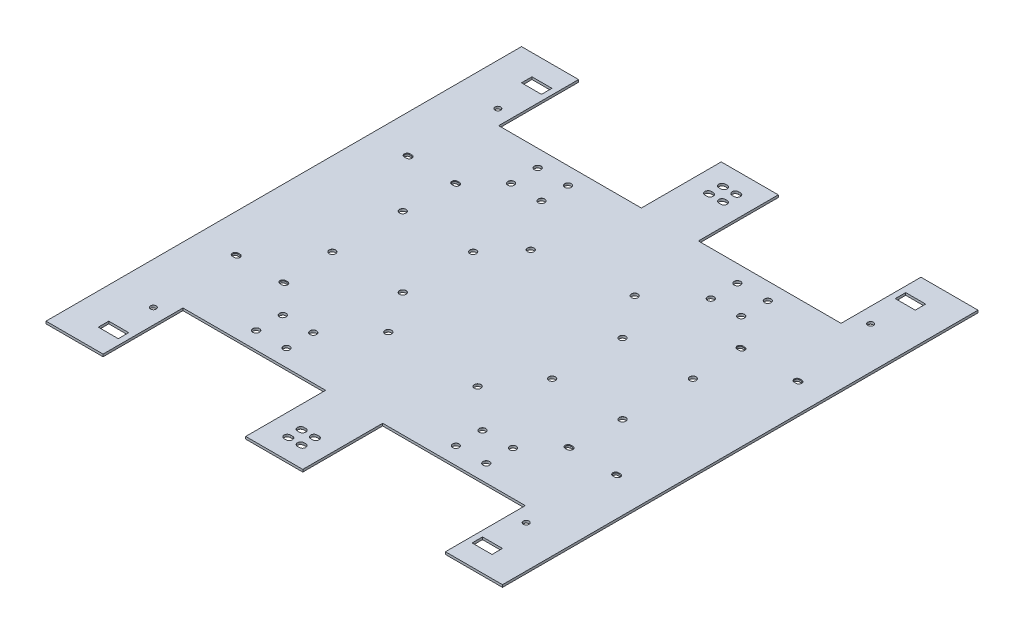
from build123d import *

# Parameters (mm, degrees)
SKETCH2_W                        = 240
SKETCH2_H                        = 1.25
BASE_FLANGE1_DEPTH               = 250
SKETCH7_W                        = 75
SKETCH7_H                        = 42
CUT_EXTRUDE1_DEPTH               = 10
SKETCH8_W                        = 10.5
SKETCH8_H                        = 5.5
CUT_EXTRUDE2_DEPTH               = 10
M3_CLEARANCE_HOLE1_D             = 3.4
M3_CLEARANCE_HOLE1_DEPTH         = 2
M3_CLEARANCE_HOLE1_CSINK_D       = 3.45
M3_CLEARANCE_HOLE1_CSINK_ANGLE   = 90
M3_CLEARANCE_HOLE1_TIP           = 1.021463052
M3_CLEARANCE_HOLE2_D             = 3.4
M3_CLEARANCE_HOLE2_DEPTH         = 2
M3_CLEARANCE_HOLE2_CSINK_D       = 3.45
M3_CLEARANCE_HOLE2_CSINK_ANGLE   = 90
M3_CLEARANCE_HOLE2_TIP           = 1.021463052
SKETCH15_R                       = 1.5
CUT_EXTRUDE3_DEPTH               = 10
TAP_START                        = -2
TAP_DRILL_SLOT_FOR_M3_TAP1_DEPTH = 3
M3_START                         = -2
M3_CLEARANCE_SLOT1_DEPTH         = 3


with BuildPart() as part:
    # Base-Flange1: sheet metal written as solids
    # Sketch2 → Base-Flange1 (new body)
    with BuildSketch(Plane.XY):
        with Locations((0, -0.625)):
            Rectangle(SKETCH2_W, SKETCH2_H)
    extrude(amount=BASE_FLANGE1_DEPTH)

    # Sketch7 → Cut-Extrude1 (cut)
    with BuildSketch(Plane(origin=(0, 0, 0), x_dir=(1, 0, 0), z_dir=(0, 1, 0))):
        with Locations((-52.5, -229)):
            Rectangle(SKETCH7_W, SKETCH7_H)
        with Locations((52.5, -229)):
            Rectangle(SKETCH7_W, SKETCH7_H)
        with Locations((52.5, -21)):
            Rectangle(SKETCH7_W, SKETCH7_H)
        with Locations((-52.5, -21)):
            Rectangle(SKETCH7_W, SKETCH7_H)
    extrude(amount=-CUT_EXTRUDE1_DEPTH, mode=Mode.SUBTRACT)

    # Sketch8 → Cut-Extrude2 (cut)
    with BuildSketch(Plane(origin=(0, 0, 0), x_dir=(1, 0, 0), z_dir=(0, 1, 0))):
        with Locations((-98.25, -236.25)):
            Rectangle(SKETCH8_W, SKETCH8_H)
        with Locations((98.25, -236.25)):
            Rectangle(SKETCH8_W, SKETCH8_H)
        with Locations((98.25, -13.75)):
            Rectangle(SKETCH8_W, SKETCH8_H)
        with Locations((-98.25, -13.75)):
            Rectangle(SKETCH8_W, SKETCH8_H)
    extrude(amount=-CUT_EXTRUDE2_DEPTH, mode=Mode.SUBTRACT)

    # M3 Clearance Hole1
    with Locations(Plane(origin=(0, 0, 0), x_dir=(1, 0, 0), z_dir=(0, 1, 0))):
        with Locations((-60.5, -65), (-44.5, -65), (-44.5, -51), (-60.5, -51), (-60.5, -185), (-44.5, -185), (-44.5, -199), (-60.5, -199), (60.5, -199), (44.5, -199), (44.5, -185), (60.5, -185), (44.5, -51), (60.5, -51), (60.5, -65), (44.5, -65)):
            CounterSinkHole(M3_CLEARANCE_HOLE1_D / 2, M3_CLEARANCE_HOLE1_CSINK_D / 2, depth=M3_CLEARANCE_HOLE1_DEPTH, counter_sink_angle=M3_CLEARANCE_HOLE1_CSINK_ANGLE)
            with Locations((0, 0, -(M3_CLEARANCE_HOLE1_DEPTH + M3_CLEARANCE_HOLE1_TIP / 2))):  # 118° drill point
                Cone(0, M3_CLEARANCE_HOLE1_D / 2, M3_CLEARANCE_HOLE1_TIP, mode=Mode.SUBTRACT)

    # M3 Clearance Hole2
    with Locations(Plane(origin=(0, 0, 0), x_dir=(1, 0, 0), z_dir=(0, 1, 0))):
        with Locations((-76.26435184, -106.15716963), (-39.26435184, -106.15716963), (-39.26435184, -143.15716963), (-76.26435184, -143.15716963), (-25.02817208, -90.1), (23.19782518, -83.70848195), (23.19782518, -166.25848195), (-25.02817208, -165), (39.26435184, -143.15716963), (39.26435184, -106.15716963), (76.26435184, -106.15716963), (76.26435184, -143.15716963)):
            CounterSinkHole(M3_CLEARANCE_HOLE2_D / 2, M3_CLEARANCE_HOLE2_CSINK_D / 2, depth=M3_CLEARANCE_HOLE2_DEPTH, counter_sink_angle=M3_CLEARANCE_HOLE2_CSINK_ANGLE)
            with Locations((0, 0, -(M3_CLEARANCE_HOLE2_DEPTH + M3_CLEARANCE_HOLE2_TIP / 2))):  # 118° drill point
                Cone(0, M3_CLEARANCE_HOLE2_D / 2, M3_CLEARANCE_HOLE2_TIP, mode=Mode.SUBTRACT)

    # Sketch15 → Cut-Extrude3 (cut)
    with BuildSketch(Plane(origin=(0, 0, 0), x_dir=(1, 0, 0), z_dir=(0, 1, 0))):
        with Locations(Location((-98, -215.54908921, 0), (0, 0, 180))):
            Circle(SKETCH15_R)
        with Locations(Location((98, -215.54908921, 0), (0, 0, 180))):
            Circle(SKETCH15_R)
        with Locations(Location((98, -34.45091079, 0), (0, 0, 180))):
            Circle(SKETCH15_R)
        with Locations(Location((-98, -34.45091079, 0), (0, 0, 180))):
            Circle(SKETCH15_R)
    extrude(amount=-CUT_EXTRUDE3_DEPTH, mode=Mode.SUBTRACT)

    # Tap Drill Slot for M3 Tap1: read off the stored shape, not the designer's step
    # Tap Drill Slot for M3 Tap1 outline → Tap Drill Slot for M3 Tap1 (cut)
    with BuildSketch(Plane(origin=(0, 0, 0), x_dir=(1, 0, 0), z_dir=(0, 1, 0)).offset(TAP_START)):
        with BuildLine():
            Line((104.5, -80.87115997), (105.5, -80.87115997))
            ThreePointArc((105.5, -80.87115997), (106.75, -79.62115997), (105.5, -78.37115997))
            Line((105.5, -78.37115997), (104.5, -78.37115997))
            ThreePointArc((104.5, -78.37115997), (103.25, -79.62115997), (104.5, -80.87115997))
        make_face()
        with BuildLine():
            ThreePointArc((74.5, -78.37115997), (73.25, -79.62115997), (74.5, -80.87115997))
            Line((74.5, -80.87115997), (75.5, -80.87115997))
            ThreePointArc((75.5, -80.87115997), (76.75, -79.62115997), (75.5, -78.37115997))
            Line((75.5, -78.37115997), (74.5, -78.37115997))
        make_face()
        with BuildLine():
            ThreePointArc((-75.5, -78.37115997), (-76.75, -79.62115997), (-75.5, -80.87115997))
            Line((-75.5, -80.87115997), (-74.5, -80.87115997))
            ThreePointArc((-74.5, -80.87115997), (-73.25, -79.62115997), (-74.5, -78.37115997))
            Line((-74.5, -78.37115997), (-75.5, -78.37115997))
        make_face()
        with BuildLine():
            ThreePointArc((-100.5, -78.37115997), (-101.75, -79.62115997), (-100.5, -80.87115997))
            Line((-100.5, -80.87115997), (-99.5, -80.87115997))
            ThreePointArc((-99.5, -80.87115997), (-98.25, -79.62115997), (-99.5, -78.37115997))
            Line((-99.5, -78.37115997), (-100.5, -78.37115997))
        make_face()
        with BuildLine():
            Line((75.5, -168.73875708), (74.5, -168.73875708))
            ThreePointArc((74.5, -168.73875708), (73.25, -169.98875708), (74.5, -171.23875708))
            Line((74.5, -171.23875708), (75.5, -171.23875708))
            ThreePointArc((75.5, -171.23875708), (76.75, -169.98875708), (75.5, -168.73875708))
        make_face()
        with BuildLine():
            ThreePointArc((100.5, -171.23875708), (101.75, -169.98875708), (100.5, -168.73875708))
            Line((100.5, -168.73875708), (99.5, -168.73875708))
            ThreePointArc((99.5, -168.73875708), (98.25, -169.98875708), (99.5, -171.23875708))
            Line((99.5, -171.23875708), (100.5, -171.23875708))
        make_face()
        with BuildLine():
            ThreePointArc((-99.5, -171.23875708), (-98.25, -169.98875708), (-99.5, -168.73875708))
            Line((-99.5, -168.73875708), (-100.5, -168.73875708))
            ThreePointArc((-100.5, -168.73875708), (-101.75, -169.98875708), (-100.5, -171.23875708))
            Line((-100.5, -171.23875708), (-99.5, -171.23875708))
        make_face()
        with BuildLine():
            ThreePointArc((-74.5, -171.23875708), (-73.25, -169.98875708), (-74.5, -168.73875708))
            Line((-74.5, -168.73875708), (-75.5, -168.73875708))
            ThreePointArc((-75.5, -168.73875708), (-76.75, -169.98875708), (-75.5, -171.23875708))
            Line((-75.5, -171.23875708), (-74.5, -171.23875708))
        make_face()
    extrude(amount=TAP_DRILL_SLOT_FOR_M3_TAP1_DEPTH, mode=Mode.SUBTRACT)

    # Tap Drill Slot for M3 Tap1 2: loft between two sections, ruled curve by curve
    tap_drill_slot_for_m3_tap1_2_from = [
        Edge.make_three_point_arc((104.5, -0.25, 78.37115997), (103.616116524, -0.25, 78.737276494), (103.25, -0.25, 79.62115997)),
        Edge.make_three_point_arc((103.25, -0.25, 79.62115997), (103.616116524, -0.25, 80.505043446), (104.5, -0.25, 80.87115997)),
        Edge.make_three_point_arc((105.5, -0.25, 80.87115997), (106.383883476, -0.25, 80.505043446), (106.75, -0.25, 79.62115997)),
        Edge.make_three_point_arc((106.75, -0.25, 79.62115997), (106.383883476, -0.25, 78.737276494), (105.5, -0.25, 78.37115997)),
        Edge.make_line((104.5, -0.25, 80.87115997), (105.5, -0.25, 80.87115997)),
        Edge.make_line((104.5, -0.25, 78.37115997), (105.5, -0.25, 78.37115997)),
    ]
    tap_drill_slot_for_m3_tap1_2_to = [
        Edge.make_three_point_arc((104.5, 0, 78.12115997), (103.439339828, 0, 78.560499798), (103, 0, 79.62115997)),
        Edge.make_three_point_arc((103, 0, 79.62115997), (103.439339828, 0, 80.681820142), (104.5, 0, 81.12115997)),
        Edge.make_three_point_arc((105.5, 0, 81.12115997), (106.560660172, 0, 80.681820142), (107, 0, 79.62115997)),
        Edge.make_three_point_arc((107, 0, 79.62115997), (106.560660172, 0, 78.560499798), (105.5, 0, 78.12115997)),
        Edge.make_line((104.5, 0, 81.12115997), (105.5, 0, 81.12115997)),
        Edge.make_line((104.5, 0, 78.12115997), (105.5, 0, 78.12115997)),
    ]
    tap_drill_slot_for_m3_tap1_2 = Solid(Shell([*[Face.make_surface_from_curves(tap_drill_slot_for_m3_tap1_2_from[k], tap_drill_slot_for_m3_tap1_2_to[k]) for k in range(6)], Face(Wire(tap_drill_slot_for_m3_tap1_2_from)), Face(Wire(tap_drill_slot_for_m3_tap1_2_to))]))
    add(tap_drill_slot_for_m3_tap1_2, mode=Mode.SUBTRACT)

    # Tap Drill Slot for M3 Tap1 3: loft between two sections, ruled curve by curve
    tap_drill_slot_for_m3_tap1_3_from = [
        Edge.make_three_point_arc((74.5, -0.25, 78.37115997), (73.616116524, -0.25, 78.737276494), (73.25, -0.25, 79.62115997)),
        Edge.make_three_point_arc((73.25, -0.25, 79.62115997), (73.616116524, -0.25, 80.505043446), (74.5, -0.25, 80.87115997)),
        Edge.make_three_point_arc((75.5, -0.25, 80.87115997), (76.383883476, -0.25, 80.505043446), (76.75, -0.25, 79.62115997)),
        Edge.make_three_point_arc((76.75, -0.25, 79.62115997), (76.383883476, -0.25, 78.737276494), (75.5, -0.25, 78.37115997)),
        Edge.make_line((74.5, -0.25, 80.87115997), (75.5, -0.25, 80.87115997)),
        Edge.make_line((74.5, -0.25, 78.37115997), (75.5, -0.25, 78.37115997)),
    ]
    tap_drill_slot_for_m3_tap1_3_to = [
        Edge.make_three_point_arc((74.5, 0, 78.12115997), (73.439339828, 0, 78.560499798), (73, 0, 79.62115997)),
        Edge.make_three_point_arc((73, 0, 79.62115997), (73.439339828, 0, 80.681820142), (74.5, 0, 81.12115997)),
        Edge.make_three_point_arc((75.5, 0, 81.12115997), (76.560660172, 0, 80.681820142), (77, 0, 79.62115997)),
        Edge.make_three_point_arc((77, 0, 79.62115997), (76.560660172, 0, 78.560499798), (75.5, 0, 78.12115997)),
        Edge.make_line((74.5, 0, 81.12115997), (75.5, 0, 81.12115997)),
        Edge.make_line((74.5, 0, 78.12115997), (75.5, 0, 78.12115997)),
    ]
    tap_drill_slot_for_m3_tap1_3 = Solid(Shell([*[Face.make_surface_from_curves(tap_drill_slot_for_m3_tap1_3_from[k], tap_drill_slot_for_m3_tap1_3_to[k]) for k in range(6)], Face(Wire(tap_drill_slot_for_m3_tap1_3_from)), Face(Wire(tap_drill_slot_for_m3_tap1_3_to))]))
    add(tap_drill_slot_for_m3_tap1_3, mode=Mode.SUBTRACT)

    # Tap Drill Slot for M3 Tap1 4: loft between two sections, ruled curve by curve
    tap_drill_slot_for_m3_tap1_4_from = [
        Edge.make_three_point_arc((-75.5, -0.25, 78.37115997), (-76.383883476, -0.25, 78.737276494), (-76.75, -0.25, 79.62115997)),
        Edge.make_three_point_arc((-76.75, -0.25, 79.62115997), (-76.383883476, -0.25, 80.505043446), (-75.5, -0.25, 80.87115997)),
        Edge.make_three_point_arc((-74.5, -0.25, 80.87115997), (-73.616116524, -0.25, 80.505043446), (-73.25, -0.25, 79.62115997)),
        Edge.make_three_point_arc((-73.25, -0.25, 79.62115997), (-73.616116524, -0.25, 78.737276494), (-74.5, -0.25, 78.37115997)),
        Edge.make_line((-75.5, -0.25, 80.87115997), (-74.5, -0.25, 80.87115997)),
        Edge.make_line((-75.5, -0.25, 78.37115997), (-74.5, -0.25, 78.37115997)),
    ]
    tap_drill_slot_for_m3_tap1_4_to = [
        Edge.make_three_point_arc((-75.5, 0, 78.12115997), (-76.560660172, 0, 78.560499798), (-77, 0, 79.62115997)),
        Edge.make_three_point_arc((-77, 0, 79.62115997), (-76.560660172, 0, 80.681820142), (-75.5, 0, 81.12115997)),
        Edge.make_three_point_arc((-74.5, 0, 81.12115997), (-73.439339828, 0, 80.681820142), (-73, 0, 79.62115997)),
        Edge.make_three_point_arc((-73, 0, 79.62115997), (-73.439339828, 0, 78.560499798), (-74.5, 0, 78.12115997)),
        Edge.make_line((-75.5, 0, 81.12115997), (-74.5, 0, 81.12115997)),
        Edge.make_line((-75.5, 0, 78.12115997), (-74.5, 0, 78.12115997)),
    ]
    tap_drill_slot_for_m3_tap1_4 = Solid(Shell([*[Face.make_surface_from_curves(tap_drill_slot_for_m3_tap1_4_from[k], tap_drill_slot_for_m3_tap1_4_to[k]) for k in range(6)], Face(Wire(tap_drill_slot_for_m3_tap1_4_from)), Face(Wire(tap_drill_slot_for_m3_tap1_4_to))]))
    add(tap_drill_slot_for_m3_tap1_4, mode=Mode.SUBTRACT)

    # Tap Drill Slot for M3 Tap1 5: loft between two sections, ruled curve by curve
    tap_drill_slot_for_m3_tap1_5_from = [
        Edge.make_three_point_arc((-100.5, -0.25, 78.37115997), (-101.383883476, -0.25, 78.737276494), (-101.75, -0.25, 79.62115997)),
        Edge.make_three_point_arc((-101.75, -0.25, 79.62115997), (-101.383883476, -0.25, 80.505043446), (-100.5, -0.25, 80.87115997)),
        Edge.make_three_point_arc((-99.5, -0.25, 80.87115997), (-98.616116524, -0.25, 80.505043446), (-98.25, -0.25, 79.62115997)),
        Edge.make_three_point_arc((-98.25, -0.25, 79.62115997), (-98.616116524, -0.25, 78.737276494), (-99.5, -0.25, 78.37115997)),
        Edge.make_line((-100.5, -0.25, 80.87115997), (-99.5, -0.25, 80.87115997)),
        Edge.make_line((-100.5, -0.25, 78.37115997), (-99.5, -0.25, 78.37115997)),
    ]
    tap_drill_slot_for_m3_tap1_5_to = [
        Edge.make_three_point_arc((-100.5, 0, 78.12115997), (-101.560660172, 0, 78.560499798), (-102, 0, 79.62115997)),
        Edge.make_three_point_arc((-102, 0, 79.62115997), (-101.560660172, 0, 80.681820142), (-100.5, 0, 81.12115997)),
        Edge.make_three_point_arc((-99.5, 0, 81.12115997), (-98.439339828, 0, 80.681820142), (-98, 0, 79.62115997)),
        Edge.make_three_point_arc((-98, 0, 79.62115997), (-98.439339828, 0, 78.560499798), (-99.5, 0, 78.12115997)),
        Edge.make_line((-100.5, 0, 81.12115997), (-99.5, 0, 81.12115997)),
        Edge.make_line((-100.5, 0, 78.12115997), (-99.5, 0, 78.12115997)),
    ]
    tap_drill_slot_for_m3_tap1_5 = Solid(Shell([*[Face.make_surface_from_curves(tap_drill_slot_for_m3_tap1_5_from[k], tap_drill_slot_for_m3_tap1_5_to[k]) for k in range(6)], Face(Wire(tap_drill_slot_for_m3_tap1_5_from)), Face(Wire(tap_drill_slot_for_m3_tap1_5_to))]))
    add(tap_drill_slot_for_m3_tap1_5, mode=Mode.SUBTRACT)

    # Tap Drill Slot for M3 Tap1 6: loft between two sections, ruled curve by curve
    tap_drill_slot_for_m3_tap1_6_from = [
        Edge.make_three_point_arc((74.5, -0.25, 168.73875708), (73.616116524, -0.25, 169.104873604), (73.25, -0.25, 169.98875708)),
        Edge.make_three_point_arc((73.25, -0.25, 169.98875708), (73.616116524, -0.25, 170.872640556), (74.5, -0.25, 171.23875708)),
        Edge.make_three_point_arc((75.5, -0.25, 171.23875708), (76.383883476, -0.25, 170.872640556), (76.75, -0.25, 169.98875708)),
        Edge.make_three_point_arc((76.75, -0.25, 169.98875708), (76.383883476, -0.25, 169.104873604), (75.5, -0.25, 168.73875708)),
        Edge.make_line((74.5, -0.25, 171.23875708), (75.5, -0.25, 171.23875708)),
        Edge.make_line((74.5, -0.25, 168.73875708), (75.5, -0.25, 168.73875708)),
    ]
    tap_drill_slot_for_m3_tap1_6_to = [
        Edge.make_three_point_arc((74.5, 0, 168.48875708), (73.439339828, 0, 168.928096908), (73, 0, 169.98875708)),
        Edge.make_three_point_arc((73, 0, 169.98875708), (73.439339828, 0, 171.049417252), (74.5, 0, 171.48875708)),
        Edge.make_three_point_arc((75.5, 0, 171.48875708), (76.560660172, 0, 171.049417252), (77, 0, 169.98875708)),
        Edge.make_three_point_arc((77, 0, 169.98875708), (76.560660172, 0, 168.928096908), (75.5, 0, 168.48875708)),
        Edge.make_line((74.5, 0, 171.48875708), (75.5, 0, 171.48875708)),
        Edge.make_line((74.5, 0, 168.48875708), (75.5, 0, 168.48875708)),
    ]
    tap_drill_slot_for_m3_tap1_6 = Solid(Shell([*[Face.make_surface_from_curves(tap_drill_slot_for_m3_tap1_6_from[k], tap_drill_slot_for_m3_tap1_6_to[k]) for k in range(6)], Face(Wire(tap_drill_slot_for_m3_tap1_6_from)), Face(Wire(tap_drill_slot_for_m3_tap1_6_to))]))
    add(tap_drill_slot_for_m3_tap1_6, mode=Mode.SUBTRACT)

    # Tap Drill Slot for M3 Tap1 7: loft between two sections, ruled curve by curve
    tap_drill_slot_for_m3_tap1_7_from = [
        Edge.make_three_point_arc((99.5, -0.25, 168.73875708), (98.616116524, -0.25, 169.104873604), (98.25, -0.25, 169.98875708)),
        Edge.make_three_point_arc((98.25, -0.25, 169.98875708), (98.616116524, -0.25, 170.872640556), (99.5, -0.25, 171.23875708)),
        Edge.make_three_point_arc((100.5, -0.25, 171.23875708), (101.383883476, -0.25, 170.872640556), (101.75, -0.25, 169.98875708)),
        Edge.make_three_point_arc((101.75, -0.25, 169.98875708), (101.383883476, -0.25, 169.104873604), (100.5, -0.25, 168.73875708)),
        Edge.make_line((99.5, -0.25, 171.23875708), (100.5, -0.25, 171.23875708)),
        Edge.make_line((99.5, -0.25, 168.73875708), (100.5, -0.25, 168.73875708)),
    ]
    tap_drill_slot_for_m3_tap1_7_to = [
        Edge.make_three_point_arc((99.5, 0, 168.48875708), (98.439339828, 0, 168.928096908), (98, 0, 169.98875708)),
        Edge.make_three_point_arc((98, 0, 169.98875708), (98.439339828, 0, 171.049417252), (99.5, 0, 171.48875708)),
        Edge.make_three_point_arc((100.5, 0, 171.48875708), (101.560660172, 0, 171.049417252), (102, 0, 169.98875708)),
        Edge.make_three_point_arc((102, 0, 169.98875708), (101.560660172, 0, 168.928096908), (100.5, 0, 168.48875708)),
        Edge.make_line((99.5, 0, 171.48875708), (100.5, 0, 171.48875708)),
        Edge.make_line((99.5, 0, 168.48875708), (100.5, 0, 168.48875708)),
    ]
    tap_drill_slot_for_m3_tap1_7 = Solid(Shell([*[Face.make_surface_from_curves(tap_drill_slot_for_m3_tap1_7_from[k], tap_drill_slot_for_m3_tap1_7_to[k]) for k in range(6)], Face(Wire(tap_drill_slot_for_m3_tap1_7_from)), Face(Wire(tap_drill_slot_for_m3_tap1_7_to))]))
    add(tap_drill_slot_for_m3_tap1_7, mode=Mode.SUBTRACT)

    # Tap Drill Slot for M3 Tap1 8: loft between two sections, ruled curve by curve
    tap_drill_slot_for_m3_tap1_8_from = [
        Edge.make_three_point_arc((-100.5, -0.25, 168.73875708), (-101.383883476, -0.25, 169.104873604), (-101.75, -0.25, 169.98875708)),
        Edge.make_three_point_arc((-101.75, -0.25, 169.98875708), (-101.383883476, -0.25, 170.872640556), (-100.5, -0.25, 171.23875708)),
        Edge.make_three_point_arc((-99.5, -0.25, 171.23875708), (-98.616116524, -0.25, 170.872640556), (-98.25, -0.25, 169.98875708)),
        Edge.make_three_point_arc((-98.25, -0.25, 169.98875708), (-98.616116524, -0.25, 169.104873604), (-99.5, -0.25, 168.73875708)),
        Edge.make_line((-100.5, -0.25, 171.23875708), (-99.5, -0.25, 171.23875708)),
        Edge.make_line((-100.5, -0.25, 168.73875708), (-99.5, -0.25, 168.73875708)),
    ]
    tap_drill_slot_for_m3_tap1_8_to = [
        Edge.make_three_point_arc((-100.5, 0, 168.48875708), (-101.560660172, 0, 168.928096908), (-102, 0, 169.98875708)),
        Edge.make_three_point_arc((-102, 0, 169.98875708), (-101.560660172, 0, 171.049417252), (-100.5, 0, 171.48875708)),
        Edge.make_three_point_arc((-99.5, 0, 171.48875708), (-98.439339828, 0, 171.049417252), (-98, 0, 169.98875708)),
        Edge.make_three_point_arc((-98, 0, 169.98875708), (-98.439339828, 0, 168.928096908), (-99.5, 0, 168.48875708)),
        Edge.make_line((-100.5, 0, 171.48875708), (-99.5, 0, 171.48875708)),
        Edge.make_line((-100.5, 0, 168.48875708), (-99.5, 0, 168.48875708)),
    ]
    tap_drill_slot_for_m3_tap1_8 = Solid(Shell([*[Face.make_surface_from_curves(tap_drill_slot_for_m3_tap1_8_from[k], tap_drill_slot_for_m3_tap1_8_to[k]) for k in range(6)], Face(Wire(tap_drill_slot_for_m3_tap1_8_from)), Face(Wire(tap_drill_slot_for_m3_tap1_8_to))]))
    add(tap_drill_slot_for_m3_tap1_8, mode=Mode.SUBTRACT)

    # Tap Drill Slot for M3 Tap1 9: loft between two sections, ruled curve by curve
    tap_drill_slot_for_m3_tap1_9_from = [
        Edge.make_three_point_arc((-75.5, -0.25, 168.73875708), (-76.383883476, -0.25, 169.104873604), (-76.75, -0.25, 169.98875708)),
        Edge.make_three_point_arc((-76.75, -0.25, 169.98875708), (-76.383883476, -0.25, 170.872640556), (-75.5, -0.25, 171.23875708)),
        Edge.make_three_point_arc((-74.5, -0.25, 171.23875708), (-73.616116524, -0.25, 170.872640556), (-73.25, -0.25, 169.98875708)),
        Edge.make_three_point_arc((-73.25, -0.25, 169.98875708), (-73.616116524, -0.25, 169.104873604), (-74.5, -0.25, 168.73875708)),
        Edge.make_line((-75.5, -0.25, 171.23875708), (-74.5, -0.25, 171.23875708)),
        Edge.make_line((-75.5, -0.25, 168.73875708), (-74.5, -0.25, 168.73875708)),
    ]
    tap_drill_slot_for_m3_tap1_9_to = [
        Edge.make_three_point_arc((-75.5, 0, 168.48875708), (-76.560660172, 0, 168.928096908), (-77, 0, 169.98875708)),
        Edge.make_three_point_arc((-77, 0, 169.98875708), (-76.560660172, 0, 171.049417252), (-75.5, 0, 171.48875708)),
        Edge.make_three_point_arc((-74.5, 0, 171.48875708), (-73.439339828, 0, 171.049417252), (-73, 0, 169.98875708)),
        Edge.make_three_point_arc((-73, 0, 169.98875708), (-73.439339828, 0, 168.928096908), (-74.5, 0, 168.48875708)),
        Edge.make_line((-75.5, 0, 171.48875708), (-74.5, 0, 171.48875708)),
        Edge.make_line((-75.5, 0, 168.48875708), (-74.5, 0, 168.48875708)),
    ]
    tap_drill_slot_for_m3_tap1_9 = Solid(Shell([*[Face.make_surface_from_curves(tap_drill_slot_for_m3_tap1_9_from[k], tap_drill_slot_for_m3_tap1_9_to[k]) for k in range(6)], Face(Wire(tap_drill_slot_for_m3_tap1_9_from)), Face(Wire(tap_drill_slot_for_m3_tap1_9_to))]))
    add(tap_drill_slot_for_m3_tap1_9, mode=Mode.SUBTRACT)

    # M3 Clearance Slot1: read off the stored shape, not the designer's step
    # M3 Clearance Slot1 outline → M3 Clearance Slot1 (cut)
    with BuildSketch(Plane(origin=(0, 0, 0), x_dir=(1, 0, 0), z_dir=(0, 1, 0)).offset(M3_START)):
        with BuildLine():
            ThreePointArc((-4.164993461, -16.05), (-5.864993461, -17.75), (-4.164993461, -19.45))
            Line((-4.164993461, -19.45), (-3.164993461, -19.45))
            ThreePointArc((-3.164993461, -19.45), (-1.464993461, -17.75), (-3.164993461, -16.05))
            Line((-3.164993461, -16.05), (-4.164993461, -16.05))
        make_face()
        with BuildLine():
            ThreePointArc((-3.863364536, -9.026451441), (-5.563364536, -10.726451441), (-3.863364536, -12.426451441))
            Line((-3.863364536, -12.426451441), (-2.863364536, -12.426451441))
            ThreePointArc((-2.863364536, -12.426451441), (-1.163364536, -10.726451441), (-2.863364536, -9.026451441))
            Line((-2.863364536, -9.026451441), (-3.863364536, -9.026451441))
        make_face()
        with BuildLine():
            ThreePointArc((4.136635464, -12.426451441), (5.836635464, -10.726451441), (4.136635464, -9.026451441))
            Line((4.136635464, -9.026451441), (3.136635464, -9.026451441))
            ThreePointArc((3.136635464, -9.026451441), (1.436635464, -10.726451441), (3.136635464, -12.426451441))
            Line((3.136635464, -12.426451441), (4.136635464, -12.426451441))
        make_face()
        with BuildLine():
            ThreePointArc((3.136635464, -15.997534094), (1.436635464, -17.697534094), (3.136635464, -19.397534094))
            Line((3.136635464, -19.397534094), (4.136635464, -19.397534094))
            ThreePointArc((4.136635464, -19.397534094), (5.836635464, -17.697534094), (4.136635464, -15.997534094))
            Line((4.136635464, -15.997534094), (3.136635464, -15.997534094))
        make_face()
        with BuildLine():
            ThreePointArc((-3.863364536, -230.55), (-5.563364536, -232.25), (-3.863364536, -233.95))
            Line((-3.863364536, -233.95), (-2.863364536, -233.95))
            ThreePointArc((-2.863364536, -233.95), (-1.163364536, -232.25), (-2.863364536, -230.55))
            Line((-2.863364536, -230.55), (-3.863364536, -230.55))
        make_face()
        with BuildLine():
            ThreePointArc((4.136635464, -233.95), (5.836635464, -232.25), (4.136635464, -230.55))
            Line((4.136635464, -230.55), (3.136635464, -230.55))
            ThreePointArc((3.136635464, -230.55), (1.436635464, -232.25), (3.136635464, -233.95))
            Line((3.136635464, -233.95), (4.136635464, -233.95))
        make_face()
        with BuildLine():
            ThreePointArc((3.136635464, -237.55), (1.436635464, -239.25), (3.136635464, -240.95))
            Line((3.136635464, -240.95), (4.136635464, -240.95))
            ThreePointArc((4.136635464, -240.95), (5.836635464, -239.25), (4.136635464, -237.55))
            Line((4.136635464, -237.55), (3.136635464, -237.55))
        make_face()
        with BuildLine():
            ThreePointArc((-2.863364536, -240.95), (-1.163364536, -239.25), (-2.863364536, -237.55))
            Line((-2.863364536, -237.55), (-3.863364536, -237.55))
            ThreePointArc((-3.863364536, -237.55), (-5.563364536, -239.25), (-3.863364536, -240.95))
            Line((-3.863364536, -240.95), (-2.863364536, -240.95))
        make_face()
    extrude(amount=M3_CLEARANCE_SLOT1_DEPTH, mode=Mode.SUBTRACT)

    # M3 Clearance Slot1 2: loft between two sections, ruled curve by curve
    m3_clearance_slot1_2_from = [
        Edge.make_three_point_arc((-4.164993461, -1.225, 19.45), (-5.367074989, -1.225, 18.952081528), (-5.864993461, -1.225, 17.75)),
        Edge.make_three_point_arc((-5.864993461, -1.225, 17.75), (-5.367074989, -1.225, 16.547918472), (-4.164993461, -1.225, 16.05)),
        Edge.make_three_point_arc((-3.164993461, -1.225, 16.05), (-1.962911933, -1.225, 16.547918472), (-1.464993461, -1.225, 17.75)),
        Edge.make_three_point_arc((-1.464993461, -1.225, 17.75), (-1.962911933, -1.225, 18.952081528), (-3.164993461, -1.225, 19.45)),
        Edge.make_line((-4.164993461, -1.225, 16.05), (-3.164993461, -1.225, 16.05)),
        Edge.make_line((-4.164993461, -1.225, 19.45), (-3.164993461, -1.225, 19.45)),
    ]
    m3_clearance_slot1_2_to = [
        Edge.make_three_point_arc((-4.164993461, -1.25, 19.475), (-5.384752658, -1.25, 18.969759198), (-5.889993461, -1.25, 17.75)),
        Edge.make_three_point_arc((-5.889993461, -1.25, 17.75), (-5.384752658, -1.25, 16.530240802), (-4.164993461, -1.25, 16.025)),
        Edge.make_three_point_arc((-3.164993461, -1.25, 16.025), (-1.945234263, -1.25, 16.530240802), (-1.439993461, -1.25, 17.75)),
        Edge.make_three_point_arc((-1.439993461, -1.25, 17.75), (-1.945234263, -1.25, 18.969759198), (-3.164993461, -1.25, 19.475)),
        Edge.make_line((-4.164993461, -1.25, 16.025), (-3.164993461, -1.25, 16.025)),
        Edge.make_line((-4.164993461, -1.25, 19.475), (-3.164993461, -1.25, 19.475)),
    ]
    m3_clearance_slot1_2 = Solid(Shell([*[Face.make_surface_from_curves(m3_clearance_slot1_2_from[k], m3_clearance_slot1_2_to[k]) for k in range(6)], Face(Wire(m3_clearance_slot1_2_from)), Face(Wire(m3_clearance_slot1_2_to))]))
    add(m3_clearance_slot1_2, mode=Mode.SUBTRACT)

    # M3 Clearance Slot1 3: loft between two sections, ruled curve by curve
    m3_clearance_slot1_3_from = [
        Edge.make_three_point_arc((-3.863364536, -1.225, 12.426451441), (-5.065446064, -1.225, 11.928532969), (-5.563364536, -1.225, 10.726451441)),
        Edge.make_three_point_arc((-5.563364536, -1.225, 10.726451441), (-5.065446064, -1.225, 9.524369913), (-3.863364536, -1.225, 9.026451441)),
        Edge.make_three_point_arc((-2.863364536, -1.225, 9.026451441), (-1.661283008, -1.225, 9.524369913), (-1.163364536, -1.225, 10.726451441)),
        Edge.make_three_point_arc((-1.163364536, -1.225, 10.726451441), (-1.661283008, -1.225, 11.928532969), (-2.863364536, -1.225, 12.426451441)),
        Edge.make_line((-3.863364536, -1.225, 9.026451441), (-2.863364536, -1.225, 9.026451441)),
        Edge.make_line((-3.863364536, -1.225, 12.426451441), (-2.863364536, -1.225, 12.426451441)),
    ]
    m3_clearance_slot1_3_to = [
        Edge.make_three_point_arc((-3.863364536, -1.25, 12.451451441), (-5.083123734, -1.25, 11.946210639), (-5.588364536, -1.25, 10.726451441)),
        Edge.make_three_point_arc((-5.588364536, -1.25, 10.726451441), (-5.083123734, -1.25, 9.506692244), (-3.863364536, -1.25, 9.001451441)),
        Edge.make_three_point_arc((-2.863364536, -1.25, 9.001451441), (-1.643605339, -1.25, 9.506692244), (-1.138364536, -1.25, 10.726451441)),
        Edge.make_three_point_arc((-1.138364536, -1.25, 10.726451441), (-1.643605339, -1.25, 11.946210639), (-2.863364536, -1.25, 12.451451441)),
        Edge.make_line((-3.863364536, -1.25, 9.001451441), (-2.863364536, -1.25, 9.001451441)),
        Edge.make_line((-3.863364536, -1.25, 12.451451441), (-2.863364536, -1.25, 12.451451441)),
    ]
    m3_clearance_slot1_3 = Solid(Shell([*[Face.make_surface_from_curves(m3_clearance_slot1_3_from[k], m3_clearance_slot1_3_to[k]) for k in range(6)], Face(Wire(m3_clearance_slot1_3_from)), Face(Wire(m3_clearance_slot1_3_to))]))
    add(m3_clearance_slot1_3, mode=Mode.SUBTRACT)

    # M3 Clearance Slot1 4: loft between two sections, ruled curve by curve
    m3_clearance_slot1_4_from = [
        Edge.make_three_point_arc((3.136635464, -1.225, 12.426451441), (1.934553936, -1.225, 11.928532969), (1.436635464, -1.225, 10.726451441)),
        Edge.make_three_point_arc((1.436635464, -1.225, 10.726451441), (1.934553936, -1.225, 9.524369913), (3.136635464, -1.225, 9.026451441)),
        Edge.make_three_point_arc((4.136635464, -1.225, 9.026451441), (5.338716992, -1.225, 9.524369913), (5.836635464, -1.225, 10.726451441)),
        Edge.make_three_point_arc((5.836635464, -1.225, 10.726451441), (5.338716992, -1.225, 11.928532969), (4.136635464, -1.225, 12.426451441)),
        Edge.make_line((3.136635464, -1.225, 9.026451441), (4.136635464, -1.225, 9.026451441)),
        Edge.make_line((3.136635464, -1.225, 12.426451441), (4.136635464, -1.225, 12.426451441)),
    ]
    m3_clearance_slot1_4_to = [
        Edge.make_three_point_arc((3.136635464, -1.25, 12.451451441), (1.916876266, -1.25, 11.946210639), (1.411635464, -1.25, 10.726451441)),
        Edge.make_three_point_arc((1.411635464, -1.25, 10.726451441), (1.916876266, -1.25, 9.506692244), (3.136635464, -1.25, 9.001451441)),
        Edge.make_three_point_arc((4.136635464, -1.25, 9.001451441), (5.356394661, -1.25, 9.506692244), (5.861635464, -1.25, 10.726451441)),
        Edge.make_three_point_arc((5.861635464, -1.25, 10.726451441), (5.356394661, -1.25, 11.946210639), (4.136635464, -1.25, 12.451451441)),
        Edge.make_line((3.136635464, -1.25, 9.001451441), (4.136635464, -1.25, 9.001451441)),
        Edge.make_line((3.136635464, -1.25, 12.451451441), (4.136635464, -1.25, 12.451451441)),
    ]
    m3_clearance_slot1_4 = Solid(Shell([*[Face.make_surface_from_curves(m3_clearance_slot1_4_from[k], m3_clearance_slot1_4_to[k]) for k in range(6)], Face(Wire(m3_clearance_slot1_4_from)), Face(Wire(m3_clearance_slot1_4_to))]))
    add(m3_clearance_slot1_4, mode=Mode.SUBTRACT)

    # M3 Clearance Slot1 5: loft between two sections, ruled curve by curve
    m3_clearance_slot1_5_from = [
        Edge.make_three_point_arc((3.136635464, -1.225, 19.397534094), (1.934553936, -1.225, 18.899615622), (1.436635464, -1.225, 17.697534094)),
        Edge.make_three_point_arc((1.436635464, -1.225, 17.697534094), (1.934553936, -1.225, 16.495452566), (3.136635464, -1.225, 15.997534094)),
        Edge.make_three_point_arc((4.136635464, -1.225, 15.997534094), (5.338716992, -1.225, 16.495452566), (5.836635464, -1.225, 17.697534094)),
        Edge.make_three_point_arc((5.836635464, -1.225, 17.697534094), (5.338716992, -1.225, 18.899615622), (4.136635464, -1.225, 19.397534094)),
        Edge.make_line((3.136635464, -1.225, 15.997534094), (4.136635464, -1.225, 15.997534094)),
        Edge.make_line((3.136635464, -1.225, 19.397534094), (4.136635464, -1.225, 19.397534094)),
    ]
    m3_clearance_slot1_5_to = [
        Edge.make_three_point_arc((3.136635464, -1.25, 19.422534094), (1.916876266, -1.25, 18.917293291), (1.411635464, -1.25, 17.697534094)),
        Edge.make_three_point_arc((1.411635464, -1.25, 17.697534094), (1.916876266, -1.25, 16.477774896), (3.136635464, -1.25, 15.972534094)),
        Edge.make_three_point_arc((4.136635464, -1.25, 15.972534094), (5.356394661, -1.25, 16.477774896), (5.861635464, -1.25, 17.697534094)),
        Edge.make_three_point_arc((5.861635464, -1.25, 17.697534094), (5.356394661, -1.25, 18.917293291), (4.136635464, -1.25, 19.422534094)),
        Edge.make_line((3.136635464, -1.25, 15.972534094), (4.136635464, -1.25, 15.972534094)),
        Edge.make_line((3.136635464, -1.25, 19.422534094), (4.136635464, -1.25, 19.422534094)),
    ]
    m3_clearance_slot1_5 = Solid(Shell([*[Face.make_surface_from_curves(m3_clearance_slot1_5_from[k], m3_clearance_slot1_5_to[k]) for k in range(6)], Face(Wire(m3_clearance_slot1_5_from)), Face(Wire(m3_clearance_slot1_5_to))]))
    add(m3_clearance_slot1_5, mode=Mode.SUBTRACT)

    # M3 Clearance Slot1 6: loft between two sections, ruled curve by curve
    m3_clearance_slot1_6_from = [
        Edge.make_three_point_arc((-3.863364536, -1.225, 233.95), (-5.065446064, -1.225, 233.452081528), (-5.563364536, -1.225, 232.25)),
        Edge.make_three_point_arc((-5.563364536, -1.225, 232.25), (-5.065446064, -1.225, 231.047918472), (-3.863364536, -1.225, 230.55)),
        Edge.make_three_point_arc((-2.863364536, -1.225, 230.55), (-1.661283008, -1.225, 231.047918472), (-1.163364536, -1.225, 232.25)),
        Edge.make_three_point_arc((-1.163364536, -1.225, 232.25), (-1.661283008, -1.225, 233.452081528), (-2.863364536, -1.225, 233.95)),
        Edge.make_line((-3.863364536, -1.225, 230.55), (-2.863364536, -1.225, 230.55)),
        Edge.make_line((-3.863364536, -1.225, 233.95), (-2.863364536, -1.225, 233.95)),
    ]
    m3_clearance_slot1_6_to = [
        Edge.make_three_point_arc((-3.863364536, -1.25, 233.975), (-5.083123734, -1.25, 233.469759198), (-5.588364536, -1.25, 232.25)),
        Edge.make_three_point_arc((-5.588364536, -1.25, 232.25), (-5.083123734, -1.25, 231.030240802), (-3.863364536, -1.25, 230.525)),
        Edge.make_three_point_arc((-2.863364536, -1.25, 230.525), (-1.643605339, -1.25, 231.030240802), (-1.138364536, -1.25, 232.25)),
        Edge.make_three_point_arc((-1.138364536, -1.25, 232.25), (-1.643605339, -1.25, 233.469759198), (-2.863364536, -1.25, 233.975)),
        Edge.make_line((-3.863364536, -1.25, 230.525), (-2.863364536, -1.25, 230.525)),
        Edge.make_line((-3.863364536, -1.25, 233.975), (-2.863364536, -1.25, 233.975)),
    ]
    m3_clearance_slot1_6 = Solid(Shell([*[Face.make_surface_from_curves(m3_clearance_slot1_6_from[k], m3_clearance_slot1_6_to[k]) for k in range(6)], Face(Wire(m3_clearance_slot1_6_from)), Face(Wire(m3_clearance_slot1_6_to))]))
    add(m3_clearance_slot1_6, mode=Mode.SUBTRACT)

    # M3 Clearance Slot1 7: loft between two sections, ruled curve by curve
    m3_clearance_slot1_7_from = [
        Edge.make_three_point_arc((3.136635464, -1.225, 233.95), (1.934553936, -1.225, 233.452081528), (1.436635464, -1.225, 232.25)),
        Edge.make_three_point_arc((1.436635464, -1.225, 232.25), (1.934553936, -1.225, 231.047918472), (3.136635464, -1.225, 230.55)),
        Edge.make_three_point_arc((4.136635464, -1.225, 230.55), (5.338716992, -1.225, 231.047918472), (5.836635464, -1.225, 232.25)),
        Edge.make_three_point_arc((5.836635464, -1.225, 232.25), (5.338716992, -1.225, 233.452081528), (4.136635464, -1.225, 233.95)),
        Edge.make_line((3.136635464, -1.225, 230.55), (4.136635464, -1.225, 230.55)),
        Edge.make_line((3.136635464, -1.225, 233.95), (4.136635464, -1.225, 233.95)),
    ]
    m3_clearance_slot1_7_to = [
        Edge.make_three_point_arc((3.136635464, -1.25, 233.975), (1.916876266, -1.25, 233.469759198), (1.411635464, -1.25, 232.25)),
        Edge.make_three_point_arc((1.411635464, -1.25, 232.25), (1.916876266, -1.25, 231.030240802), (3.136635464, -1.25, 230.525)),
        Edge.make_three_point_arc((4.136635464, -1.25, 230.525), (5.356394661, -1.25, 231.030240802), (5.861635464, -1.25, 232.25)),
        Edge.make_three_point_arc((5.861635464, -1.25, 232.25), (5.356394661, -1.25, 233.469759198), (4.136635464, -1.25, 233.975)),
        Edge.make_line((3.136635464, -1.25, 230.525), (4.136635464, -1.25, 230.525)),
        Edge.make_line((3.136635464, -1.25, 233.975), (4.136635464, -1.25, 233.975)),
    ]
    m3_clearance_slot1_7 = Solid(Shell([*[Face.make_surface_from_curves(m3_clearance_slot1_7_from[k], m3_clearance_slot1_7_to[k]) for k in range(6)], Face(Wire(m3_clearance_slot1_7_from)), Face(Wire(m3_clearance_slot1_7_to))]))
    add(m3_clearance_slot1_7, mode=Mode.SUBTRACT)

    # M3 Clearance Slot1 8: loft between two sections, ruled curve by curve
    m3_clearance_slot1_8_from = [
        Edge.make_three_point_arc((3.136635464, -1.225, 240.95), (1.934553936, -1.225, 240.452081528), (1.436635464, -1.225, 239.25)),
        Edge.make_three_point_arc((1.436635464, -1.225, 239.25), (1.934553936, -1.225, 238.047918472), (3.136635464, -1.225, 237.55)),
        Edge.make_three_point_arc((4.136635464, -1.225, 237.55), (5.338716992, -1.225, 238.047918472), (5.836635464, -1.225, 239.25)),
        Edge.make_three_point_arc((5.836635464, -1.225, 239.25), (5.338716992, -1.225, 240.452081528), (4.136635464, -1.225, 240.95)),
        Edge.make_line((3.136635464, -1.225, 237.55), (4.136635464, -1.225, 237.55)),
        Edge.make_line((3.136635464, -1.225, 240.95), (4.136635464, -1.225, 240.95)),
    ]
    m3_clearance_slot1_8_to = [
        Edge.make_three_point_arc((3.136635464, -1.25, 240.975), (1.916876266, -1.25, 240.469759198), (1.411635464, -1.25, 239.25)),
        Edge.make_three_point_arc((1.411635464, -1.25, 239.25), (1.916876266, -1.25, 238.030240802), (3.136635464, -1.25, 237.525)),
        Edge.make_three_point_arc((4.136635464, -1.25, 237.525), (5.356394661, -1.25, 238.030240802), (5.861635464, -1.25, 239.25)),
        Edge.make_three_point_arc((5.861635464, -1.25, 239.25), (5.356394661, -1.25, 240.469759198), (4.136635464, -1.25, 240.975)),
        Edge.make_line((3.136635464, -1.25, 237.525), (4.136635464, -1.25, 237.525)),
        Edge.make_line((3.136635464, -1.25, 240.975), (4.136635464, -1.25, 240.975)),
    ]
    m3_clearance_slot1_8 = Solid(Shell([*[Face.make_surface_from_curves(m3_clearance_slot1_8_from[k], m3_clearance_slot1_8_to[k]) for k in range(6)], Face(Wire(m3_clearance_slot1_8_from)), Face(Wire(m3_clearance_slot1_8_to))]))
    add(m3_clearance_slot1_8, mode=Mode.SUBTRACT)

    # M3 Clearance Slot1 9: loft between two sections, ruled curve by curve
    m3_clearance_slot1_9_from = [
        Edge.make_three_point_arc((-3.863364536, -1.225, 240.95), (-5.065446064, -1.225, 240.452081528), (-5.563364536, -1.225, 239.25)),
        Edge.make_three_point_arc((-5.563364536, -1.225, 239.25), (-5.065446064, -1.225, 238.047918472), (-3.863364536, -1.225, 237.55)),
        Edge.make_three_point_arc((-2.863364536, -1.225, 237.55), (-1.661283008, -1.225, 238.047918472), (-1.163364536, -1.225, 239.25)),
        Edge.make_three_point_arc((-1.163364536, -1.225, 239.25), (-1.661283008, -1.225, 240.452081528), (-2.863364536, -1.225, 240.95)),
        Edge.make_line((-3.863364536, -1.225, 237.55), (-2.863364536, -1.225, 237.55)),
        Edge.make_line((-3.863364536, -1.225, 240.95), (-2.863364536, -1.225, 240.95)),
    ]
    m3_clearance_slot1_9_to = [
        Edge.make_three_point_arc((-3.863364536, -1.25, 240.975), (-5.083123734, -1.25, 240.469759198), (-5.588364536, -1.25, 239.25)),
        Edge.make_three_point_arc((-5.588364536, -1.25, 239.25), (-5.083123734, -1.25, 238.030240802), (-3.863364536, -1.25, 237.525)),
        Edge.make_three_point_arc((-2.863364536, -1.25, 237.525), (-1.643605339, -1.25, 238.030240802), (-1.138364536, -1.25, 239.25)),
        Edge.make_three_point_arc((-1.138364536, -1.25, 239.25), (-1.643605339, -1.25, 240.469759198), (-2.863364536, -1.25, 240.975)),
        Edge.make_line((-3.863364536, -1.25, 237.525), (-2.863364536, -1.25, 237.525)),
        Edge.make_line((-3.863364536, -1.25, 240.975), (-2.863364536, -1.25, 240.975)),
    ]
    m3_clearance_slot1_9 = Solid(Shell([*[Face.make_surface_from_curves(m3_clearance_slot1_9_from[k], m3_clearance_slot1_9_to[k]) for k in range(6)], Face(Wire(m3_clearance_slot1_9_from)), Face(Wire(m3_clearance_slot1_9_to))]))
    add(m3_clearance_slot1_9, mode=Mode.SUBTRACT)


solid = part.part
